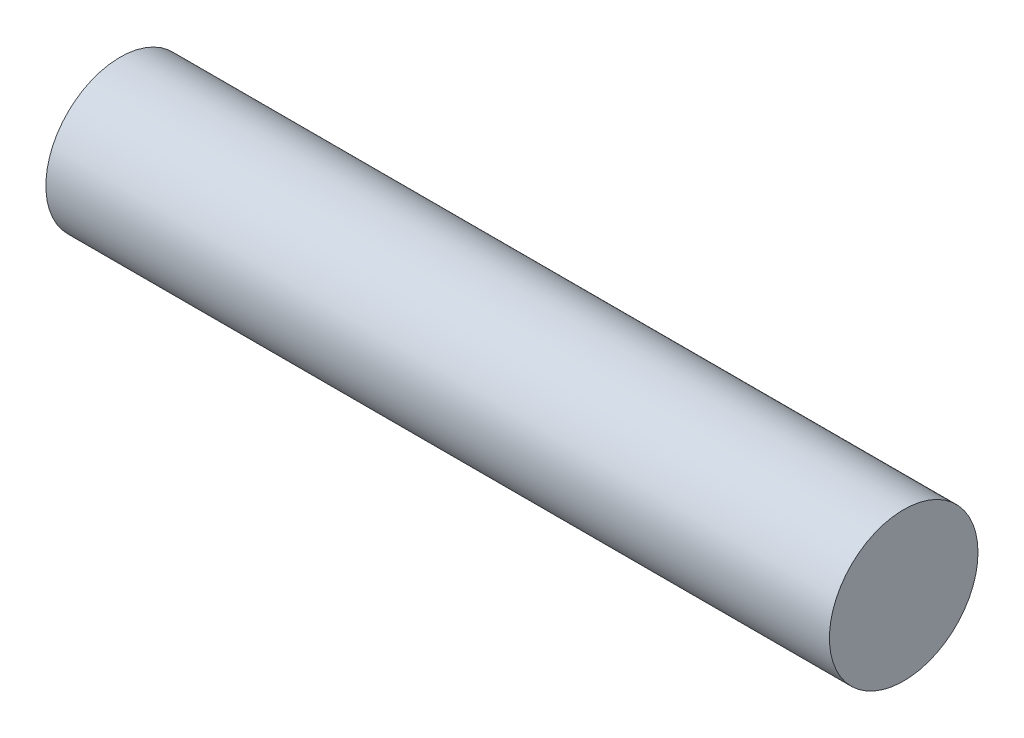
from build123d import *

# Parameters (mm, degrees)
SKETCH1_R           = 1.50495
BOSS_EXTRUDE1_DEPTH = 7.9375


with BuildPart() as part:
    # Sketch1 → Boss-Extrude1 (new, symmetric)
    with BuildSketch(Plane(origin=(0, 0, 0), x_dir=(0, 0, -1), z_dir=(1, 0, 0))):
        Circle(SKETCH1_R)
    extrude(amount=BOSS_EXTRUDE1_DEPTH, both=True)


solid = part.part
